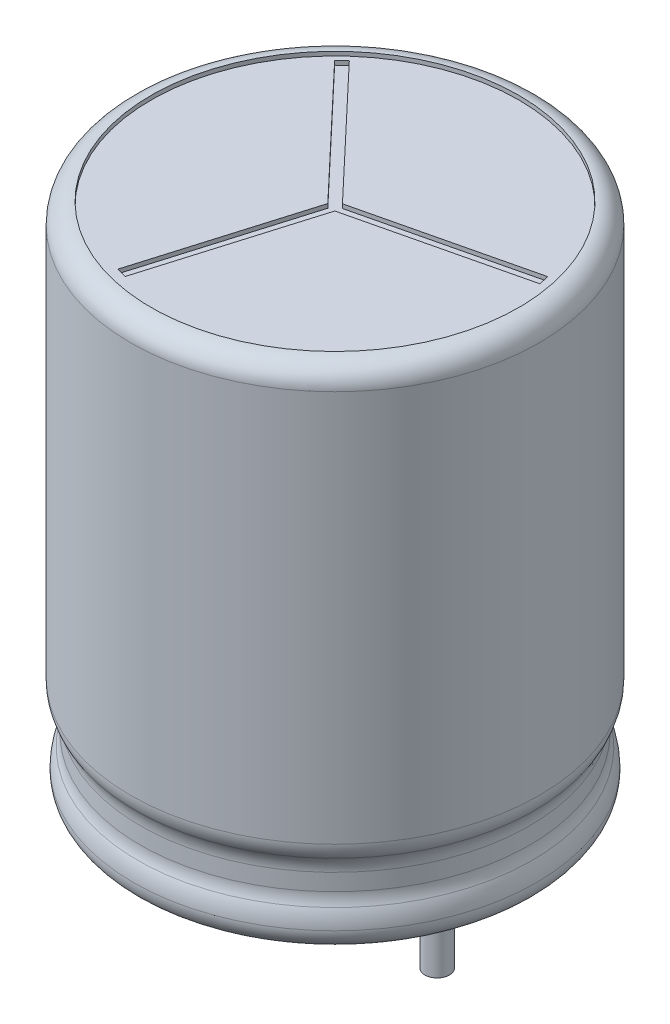
from build123d import *

# Parameters (mm, degrees)
SKETCH2_R          = 4.5
CUT_EXTRUDE1_DEPTH = 0.1
CUT_EXTRUDE2_DEPTH = 0.1
SKETCH4_W          = 0.3
SKETCH4_H          = 2.5
FILLET1_R          = 0.5


with BuildPart() as part:
    # Sketch1 → Revolve1 (revolve)
    with BuildSketch(Plane.XY, mode=Mode.PRIVATE) as revolve1_sk:
        with BuildLine():
            Line((5, 12.5), (0, 12.5))
            Line((0, 12.5), (0, 0))
            Line((0, 0), (4.827244523, 0))
            ThreePointArc((4.827244523, 0), (4.933458385, 0.471594976), (4.82617218, 0.942947155))
            ThreePointArc((4.82617218, 0.942947155), (4.777062056, 1.084088077), (4.760416667, 1.232599004))
            Line((4.760416667, 1.232599004), (4.760416667, 1.642400996))
            ThreePointArc((4.760416667, 1.642400996), (4.791064683, 1.842850794), (4.880208333, 2.024984899))
            ThreePointArc((4.880208333, 2.024984899), (4.969351983, 2.207119004), (5, 2.407568802))
            Line((5, 2.407568802), (5, 12.5))
        make_face()
    revolve(revolve1_sk.sketch.rotate(Axis((0, 12.5, 0), (0, -1, 0)), 270), axis=Axis((0, 12.5, 0), (0, -1, 0)))

    # Sketch2 → Cut-Extrude1 (cut)
    with BuildSketch(Plane(origin=(0, 12.5, 0), x_dir=(-1, 0, 0), z_dir=(0, 1, 0))):
        with Locations(Location((0, 0, 0), (0, 0, 270))):
            Circle(SKETCH2_R)
    extrude(amount=-CUT_EXTRUDE1_DEPTH, mode=Mode.SUBTRACT)

    # Sketch3 → Cut-Extrude2 (cut)
    with BuildSketch(Plane(origin=(0, 12.4, 0), x_dir=(-1, 0, 0), z_dir=(0, 1, 0))):
        Polygon((2.906036622, -3.256093686), (3.090537324, -3.081521376), (0.142645036, 0.03402539), (1.320649975, 3.989641976), (1.07721557, 4.062138116), (-0.10078937, 0.10652153), (-4.155587963, -0.860677244), (-4.096654259, -1.107745693), (-0.041855666, -0.14054692), align=None)
    extrude(amount=-CUT_EXTRUDE2_DEPTH, mode=Mode.SUBTRACT)

    # Sketch4 → Revolve2 (revolve)
    with BuildSketch(Plane(origin=(0, 0, 0), x_dir=(-1, 0, 0), z_dir=(0, 0, -1)), mode=Mode.PRIVATE) as revolve2_sk:
        with Locations((-2.65, -1.25)):
            Rectangle(SKETCH4_W, SKETCH4_H)
    revolve2 = revolve(revolve2_sk.sketch.rotate(Axis((2.5, -2.5, 0), (0, 1, 0)), 270), axis=Axis((2.5, -2.5, 0), (0, 1, 0)))

    # Fillet1
    fillet1_edges = [part.edges().sort_by_distance(p)[0] for p in [
        (0, 12.5, 5),
        (0, 0, 4.827244523),
    ]]
    fillet(fillet1_edges, radius=FILLET1_R - 0.0001)  # a hair under: the kernel refuses the full size

    # Simetría3: Revolve2 across plane
    add(revolve2.mirror(Plane(origin=(0, 0, 0), x_dir=(0, 0, 1), z_dir=(1, 0, 0))))


solid = part.part
